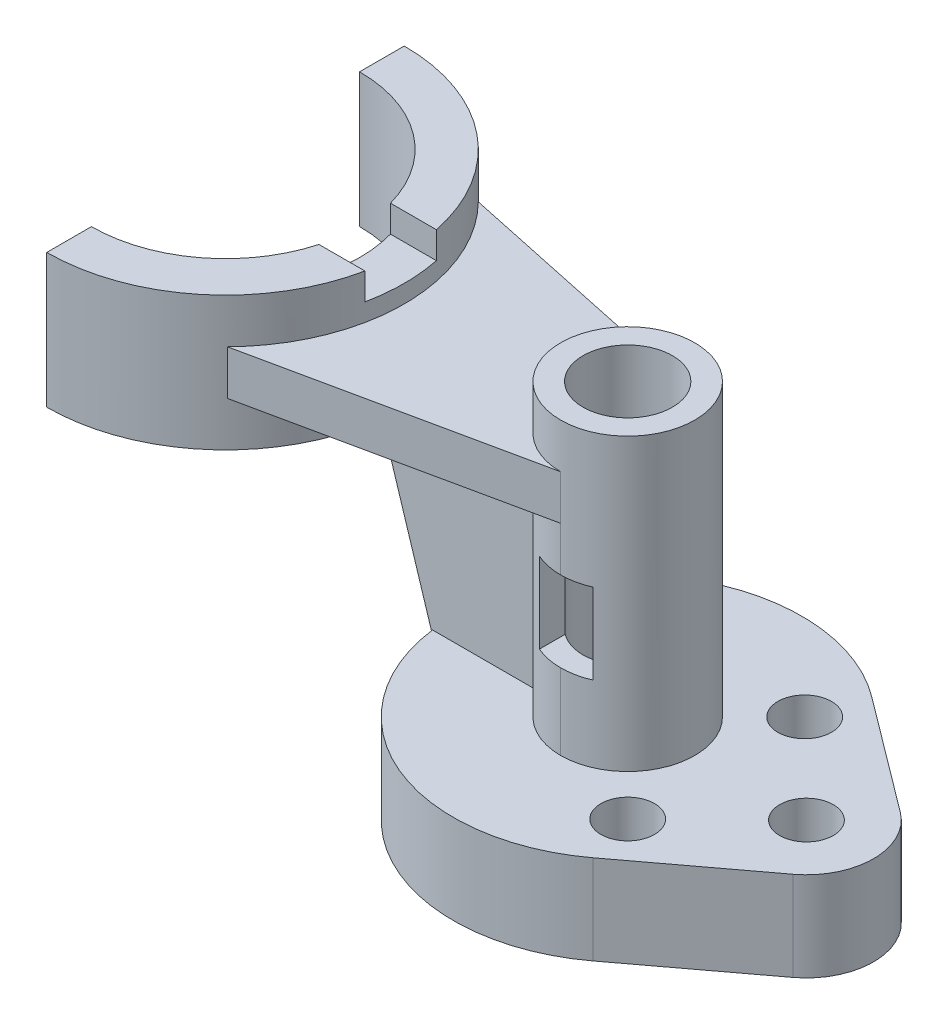
from build123d import *

# Parameters (mm, degrees)
LOCAL_FILES1_R          = 6
BOSS_EXTRUDE1_DEPTH     = 20
LOCAL_FILES2_R          = 15
LOCAL_FILES2_R_2        = 10
BOSS_EXTRUDE2_DEPTH     = 65
LOCAL_FILES2_4_R        = 10
CUT_EXTRUDE3_DEPTH      = 94.653617122
BOSS_EXTRUDE3_DEPTH     = 30
BOSS_EXTRUDE4_START     = -20
BOSS_EXTRUDE4_DEPTH     = 10
CUT_EXTRUDE4_DEPTH      = 6
CUT_EXTRUDE5_DEPTH      = 131.096118313
CUT_EXTRUDE5_DEPTH_BACK = 131.096118313
LOCAL_FILES6_W          = 12
LOCAL_FILES6_H          = 18
RIB1_REACH              = 132.096
LOCAL_FILES7_WALL_W     = 298.88010928
LOCAL_FILES7_WALL_H     = 10


with BuildPart() as part:
    # Local Files1 → Boss-Extrude1 (new body)
    with BuildSketch(Plane(origin=(0, 0, 0), x_dir=(1, 0, 0), z_dir=(0, 1, 0))):
        with BuildLine():
            Line((49, 12), (23.4, 31.2))
            ThreePointArc((23.4, 31.2), (-39, 0), (23.4, -31.2))
            Line((23.4, -31.2), (49, -12))
            ThreePointArc((49, -12), (55, 0), (49, 12))
        make_face()
        with Locations((40, 0)):
            Circle(LOCAL_FILES1_R, mode=Mode.SUBTRACT)
        with Locations((19.798989873, 19.798989873)):
            Circle(LOCAL_FILES1_R, mode=Mode.SUBTRACT)
        with Locations((19.798989873, -19.798989873)):
            Circle(LOCAL_FILES1_R, mode=Mode.SUBTRACT)
    extrude(amount=BOSS_EXTRUDE1_DEPTH)

    # Local Files2 → Boss-Extrude2 (add)
    with BuildSketch(Plane(origin=(0, 20, 0), x_dir=(1, 0, 0), z_dir=(0, 1, 0))):
        Circle(LOCAL_FILES2_R)
        Circle(LOCAL_FILES2_R_2, mode=Mode.SUBTRACT)
    extrude(amount=BOSS_EXTRUDE2_DEPTH)

    # Local Files2<4> → Cut-Extrude3 (cut, through all)
    with BuildSketch(Plane(origin=(0, 20, 0), x_dir=(1, 0, 0), z_dir=(0, 1, 0))):
        Circle(LOCAL_FILES2_4_R)
    extrude(amount=-CUT_EXTRUDE3_DEPTH, mode=Mode.SUBTRACT)



with BuildPart() as body_2:
    # Local Files4 → Boss-Extrude3 (new body)
    with BuildSketch(Plane(origin=(0, 85, 0), x_dir=(1, 0, 0), z_dir=(0, 1, 0))):
        with BuildLine():
            ThreePointArc((-90, 30), (-60, 0), (-90, -30))
            Line((-90, -30), (-90, -40))
            ThreePointArc((-90, -40), (-50, 0), (-90, 40))
            Line((-90, 40), (-90, 30))
        make_face()
    extrude(amount=-BOSS_EXTRUDE3_DEPTH)


with BuildPart() as part_1:
    add(part.part)

    add(body_2.part)  # Boss-Extrude4 merges body 2
    # Local Files4<3> → Boss-Extrude4 (add)
    with BuildSketch(Plane(origin=(0, 85, 0), x_dir=(1, 0, 0), z_dir=(0, 1, 0)).offset(BOSS_EXTRUDE4_START)):
        with BuildLine():
            ThreePointArc((-61.506658253, 28.073643798), (-50, 0), (-61.506658253, -28.073643798))
            Line((-61.506658253, -28.073643798), (0, -15))
            ThreePointArc((0, -15), (-15, 0), (0, 15))
            Line((0, 15), (-61.506658253, 28.073643798))
        make_face()
    extrude(amount=BOSS_EXTRUDE4_DEPTH)

    # Local Files5 → Cut-Extrude4 (cut)
    with BuildSketch(Plane(origin=(0, 85, 0), x_dir=(1, 0, 0), z_dir=(0, 1, 0))):
        with BuildLine():
            Line((-61.08633541, 8), (-50.808164115, 8))
            ThreePointArc((-50.808164115, 8), (-50, 0), (-50.808164115, -8))
            Line((-50.808164115, -8), (-61.08633541, -8))
            ThreePointArc((-61.08633541, -8), (-60, 0), (-61.08633541, 8))
        make_face()
    extrude(amount=-CUT_EXTRUDE4_DEPTH, mode=Mode.SUBTRACT)

    # Local Files6 → Cut-Extrude5 (cut, two sides: drawn at the far end of the back side and taken through both)
    with BuildSketch(Plane.XY.offset(-CUT_EXTRUDE5_DEPTH_BACK)):
        with Locations((0, 46)):
            Rectangle(LOCAL_FILES6_W, LOCAL_FILES6_H)
    extrude(amount=CUT_EXTRUDE5_DEPTH + CUT_EXTRUDE5_DEPTH_BACK, mode=Mode.SUBTRACT)

    # Local Files7 wall → Rib1 (add, up to next)
    with BuildSketch(Plane(origin=(-44.5, 37.5, 0), x_dir=(-0.29982659674, 0.953993716901, 0), z_dir=(-0.953993716901, -0.29982659674, 0)), mode=Mode.PRIVATE) as rib1_sk1:
        Rectangle(LOCAL_FILES7_WALL_W, LOCAL_FILES7_WALL_H)
    rib1_tool1 = extrude(rib1_sk1.sketch, amount=-RIB1_REACH, mode=Mode.PRIVATE) - part_1.part
    add(rib1_tool1.solids().sort_by_distance((-44.5, 37.5, 0))[0])


solid = part_1.part
